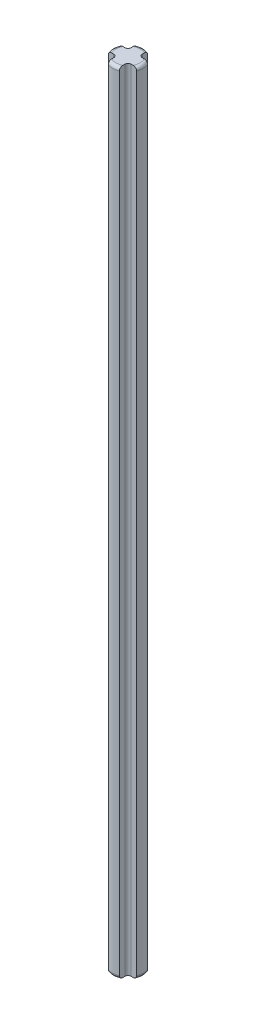
from build123d import *

# Parameters (mm, degrees)
SKETCH1_W          = 2.39
SKETCH1_H          = 124
CUT_EXTRUDE1_DEPTH = 125.046056769
FILLET1_R          = 0.5


with BuildPart() as part:
    # Sketch1 → Revolve1 (revolve)
    with BuildSketch(Plane(origin=(0, 0, 0), x_dir=(-1, 0, 0), z_dir=(0, 0, -1))):
        with Locations((-1.195, 62)):
            Rectangle(SKETCH1_W, SKETCH1_H)
    revolve(axis=Axis((0, 0, 0), (0, 1, 0)))

    # Sketch2 → Cut-Extrude1 (cut, through all)
    with BuildSketch(Plane.XZ):
        with BuildLine():
            Line((0.875, 2.22406722), (0.875, 0.875))
            Line((0.875, 0.875), (2.22406722, 0.875))
            ThreePointArc((2.22406722, 0.875), (1.689985207, 1.689985207), (0.875, 2.22406722))
        make_face()
        with BuildLine():
            Line((0.875, -0.875), (2.22406722, -0.875))
            ThreePointArc((2.22406722, -0.875), (1.689985207, -1.689985207), (0.875, -2.22406722))
            Line((0.875, -2.22406722), (0.875, -0.875))
        make_face()
        with BuildLine():
            Line((-0.875, -2.22406722), (-0.875, -0.875))
            Line((-0.875, -0.875), (-2.22406722, -0.875))
            ThreePointArc((-2.22406722, -0.875), (-1.689985207, -1.689985207), (-0.875, -2.22406722))
        make_face()
        with BuildLine():
            Line((-0.875, 0.875), (-2.22406722, 0.875))
            ThreePointArc((-2.22406722, 0.875), (-1.689985207, 1.689985207), (-0.875, 2.22406722))
            Line((-0.875, 2.22406722), (-0.875, 0.875))
        make_face()
    extrude(amount=-CUT_EXTRUDE1_DEPTH, mode=Mode.SUBTRACT)

    # Fillet1
    fillet1_edges = [part.edges().sort_by_distance(p)[0] for p in [
        (2.39, 0, 0),
        (0, 0, 2.39),
        (0, 124, 2.39),
        (0.875, 62, 0.875),
        (2.39, 124, 0),
        (-2.39, 124, 0),
        (0, 124, -2.39),
        (0.875, 62, -0.875),
        (-0.875, 62, -0.875),
        (0, 0, -2.39),
        (-2.39, 0, 0),
        (-0.875, 62, 0.875),
    ]]
    fillet(fillet1_edges, radius=FILLET1_R)


solid = part.part
